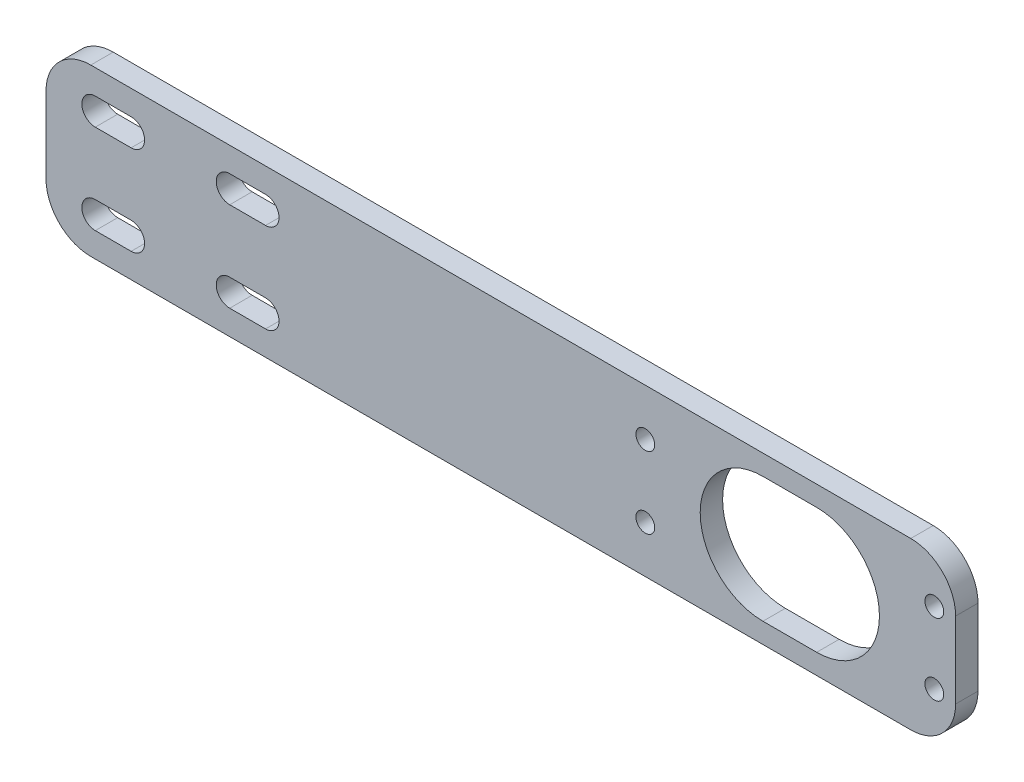
from build123d import *

# Parameters (mm, degrees)
SKETCH_1_W             = 203
SKETCH_1_H             = 37
SM_BASE_FLANGE_1_DEPTH = 5
FILLET_1_R             = 10
CUT_EXTRUDE_1_DEPTH    = 10
CUT_EXTRUDE_2_DEPTH    = 10
HOLE_WIZARD_M5_1_D     = 4.2
HOLE_WIZARD_M5_1_DEPTH = 12.4
HOLE_WIZARD_M5_1_TIP   = 1.2618073


# Sheet-metal steps are written as plain solids
with BuildPart() as part:
    # Sketch 1 → 基体-法兰1 (new body)
    with BuildSketch(Plane.XY):
        Rectangle(SKETCH_1_W, SKETCH_1_H)
    extrude(amount=-SM_BASE_FLANGE_1_DEPTH)

    # 圆角1
    fillet_1_edges = [part.edges().sort_by_distance(p)[0] for p in [
        (101.5, -18.5, -2.5),
        (-101.5, -18.5, -2.5),
        (-101.5, 18.5, -2.5),
        (101.5, 18.5, -2.5),
    ]]
    fillet(fillet_1_edges, radius=FILLET_1_R)

    # Sketch 2 → 切除-拉伸1 (cut)
    with BuildSketch(Plane(origin=(0, 0, -5), x_dir=(-1, 0, 0), z_dir=(0, 0, -1))):
        with BuildLine():
            Line((-58.5, -14), (-70.5, -14))
            ThreePointArc((-70.5, -14), (-84.5, 0), (-70.5, 14))
            Line((-70.5, 14), (-58.5, 14))
            ThreePointArc((-58.5, 14), (-44.5, 0), (-58.5, -14))
        make_face()
    extrude(amount=-CUT_EXTRUDE_1_DEPTH, mode=Mode.SUBTRACT)

    # 草图3 → 切除-拉伸2 (cut)
    with BuildSketch(Plane(origin=(0, 0, -5), x_dir=(-1, 0, 0), z_dir=(0, 0, -1))):
        with BuildLine():
            Line((60.5, -13), (52.5, -13))
            ThreePointArc((52.5, -13), (49.5, -10), (52.5, -7))
            Line((52.5, -7), (60.5, -7))
            ThreePointArc((60.5, -7), (63.5, -10), (60.5, -13))
        make_face()
        with BuildLine():
            Line((60.5, 7), (52.5, 7))
            ThreePointArc((52.5, 7), (49.5, 10), (52.5, 13))
            Line((52.5, 13), (60.5, 13))
            ThreePointArc((60.5, 13), (63.5, 10), (60.5, 7))
        make_face()
        with BuildLine():
            Line((82.5, 13), (90.5, 13))
            ThreePointArc((90.5, 13), (93.5, 10), (90.5, 7))
            Line((90.5, 7), (82.5, 7))
            ThreePointArc((82.5, 7), (79.5, 10), (82.5, 13))
        make_face()
        with BuildLine():
            Line((82.5, -7), (90.5, -7))
            ThreePointArc((90.5, -7), (93.5, -10), (90.5, -13))
            Line((90.5, -13), (82.5, -13))
            ThreePointArc((82.5, -13), (79.5, -10), (82.5, -7))
        make_face()
    extrude(amount=-CUT_EXTRUDE_2_DEPTH, mode=Mode.SUBTRACT)

    # M5 螺纹孔1
    with Locations(Plane(origin=(0, 0, -5), x_dir=(-1, 0, 0), z_dir=(0, 0, -1))):
        with Locations((-96.75, -7.9995), (-96.75, 8.0005), (-32.25, 8.0005), (-32.25, -7.9995)):
            Hole(HOLE_WIZARD_M5_1_D / 2, depth=HOLE_WIZARD_M5_1_DEPTH)
            with Locations((0, 0, -(HOLE_WIZARD_M5_1_DEPTH + HOLE_WIZARD_M5_1_TIP / 2))):  # 118° drill point
                Cone(0, HOLE_WIZARD_M5_1_D / 2, HOLE_WIZARD_M5_1_TIP, mode=Mode.SUBTRACT)


solid = part.part
